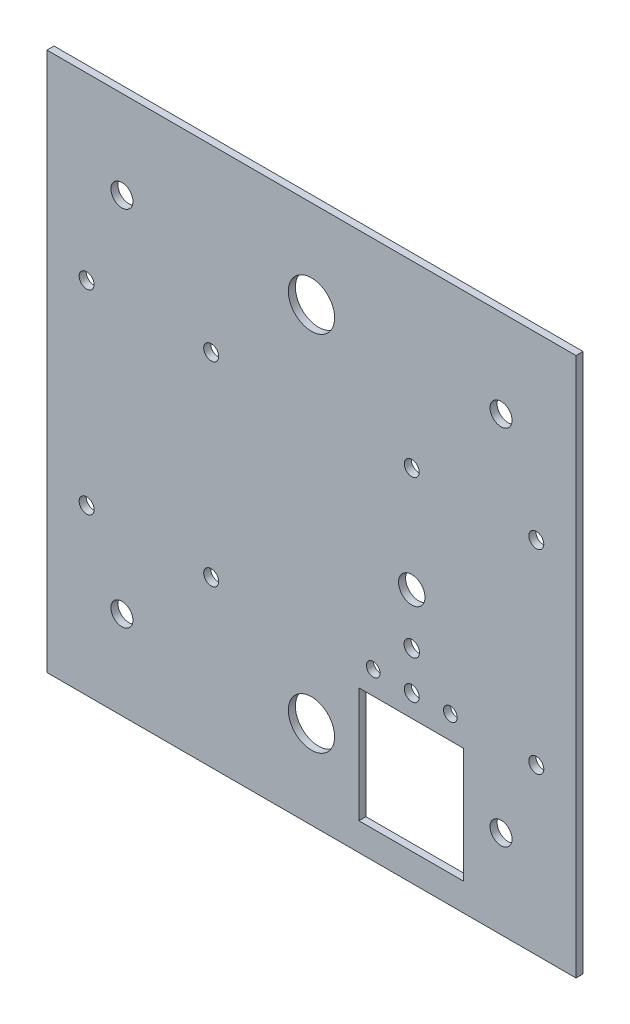
from build123d import *

# Parameters (mm, degrees)
SKETCH1_R                  = 5.25
SKETCH1_R_2                = 2.5
BOSS_EXTRUDE1_DEPTH        = 1.6
SKETCH3_W                  = 120
SKETCH3_H                  = 1.6
BOSS_EXTRUDE3_DEPTH        = 60
SKETCH4_R                  = 3
SKETCH4_R_2                = 1.55
SKETCH4_R_3                = 1.75
CUT_EXTRUDE1_DEPTH         = 10
SKETCH6_R                  = 1.7
CUT_EXTRUDE2_DEPTH         = 25
CONVERT_SOLID1_START       = -61
CONVERT_SOLID1_DEPTH       = 122
CONVERT_SOLID1_START_2     = -60
CONVERT_SOLID1_2_DEPTH     = 120
CUT_EXTRUDE3_OUTLINE_W     = 120
CUT_EXTRUDE3_OUTLINE_H     = 60
CUT_EXTRUDE3_OUTLINE_R     = 1.7
CUT_EXTRUDE3_OUTLINE_R_2   = 1.55
CUT_EXTRUDE3_OUTLINE_R_3   = 1.75
CUT_EXTRUDE3_OUTLINE_R_4   = 3
CUT_EXTRUDE3_DEPTH         = 32
CUT_EXTRUDE3_START         = -1.6
CUT_EXTRUDE3_2_OUTLINE_W   = 23.75
CUT_EXTRUDE3_2_OUTLINE_H   = 1.229203673
CUT_EXTRUDE3_2_DEPTH       = 1.6
CUT_EXTRUDE3_3_OUTLINE_W   = 120
CUT_EXTRUDE3_3_OUTLINE_H   = 122.283185308
CUT_EXTRUDE3_3_OUTLINE_W_2 = 23.75
CUT_EXTRUDE3_3_OUTLINE_H_2 = 26.1
CUT_EXTRUDE3_3_OUTLINE_R   = 2.5
CUT_EXTRUDE3_3_OUTLINE_R_2 = 5.25
CUT_EXTRUDE3_3_OUTLINE_R_3 = 1.7
CUT_EXTRUDE3_3_OUTLINE_R_4 = 1.55
CUT_EXTRUDE3_3_OUTLINE_R_5 = 1.75
CUT_EXTRUDE3_3_OUTLINE_R_6 = 3
CUT_EXTRUDE3_3_DEPTH       = 1.6


with BuildPart() as part:
    # Sketch1 → Boss-Extrude1 (new body)
    with BuildSketch(Plane(origin=(0, 0, 0), x_dir=(1, 0, 0), z_dir=(0, 1, 0))):
        Polygon((-60, -12), (-60, 20), (60, 20), (60, -12), (34.5, -12), (11, -12), align=None)
        with Locations(Location((0, 0, 0), (0, 0, 270))):
            Circle(SKETCH1_R, mode=Mode.SUBTRACT)
        with Locations(Location((-43, 0, 0), (0, 0, 270))):
            Circle(SKETCH1_R_2, mode=Mode.SUBTRACT)
        with Locations(Location((43, 0, 0), (0, 0, 90))):
            Circle(SKETCH1_R_2, mode=Mode.SUBTRACT)
    boss_extrude1 = extrude(amount=BOSS_EXTRUDE1_DEPTH)

    # Sketch3 → Boss-Extrude3 (add)
    with BuildSketch(Plane.XZ):
        with Locations((0, 12.8)):
            Rectangle(SKETCH3_W, SKETCH3_H)
    extrude(amount=-BOSS_EXTRUDE3_DEPTH)

    # Mirror1: Boss-Extrude1 across plane
    add(boss_extrude1.mirror(Plane.ZX.offset(30)))

    # Sketch4 → Cut-Extrude1 (cut)
    with BuildSketch(Plane.XY.offset(12)):
        with Locations(Location((22.75, 26.5, 0), (0, 0, 180))):
            Circle(SKETCH4_R)
        with Locations(Location((31.5, 6.5, 0), (0, 0, 180))):
            Circle(SKETCH4_R_2)
        with Locations(Location((14, 6.5, 0), (0, 0, 180))):
            Circle(SKETCH4_R_2)
        with Locations(Location((22.75, 15, 0), (0, 0, 180))):
            Circle(SKETCH4_R_3)
    extrude(amount=CUT_EXTRUDE1_DEPTH, mode=Mode.SUBTRACT)

    # Sketch6 → Cut-Extrude2 (cut)
    with BuildSketch(Plane(origin=(124.244525073, 40.7, 12), x_dir=(1, 0, 0), z_dir=(0, 0, 1))):
        with Locations(Location((-175.244525073, 9.7, 0), (0, 0, 180))):
            Circle(SKETCH6_R)
        with Locations(Location((-146.994525073, 9.7, 0), (0, 0, 180))):
            Circle(SKETCH6_R)
        with Locations(Location((-101.494525073, 9.7, 0), (0, 0, 180))):
            Circle(SKETCH6_R)
        with Locations(Location((-73.244525073, 9.7, 0), (0, 0, 180))):
            Circle(SKETCH6_R)
        with Locations((-175.244525073, -34.5)):
            Circle(SKETCH6_R)
        with Locations((-146.994525073, -34.5)):
            Circle(SKETCH6_R)
        with Locations(Location((-101.494525073, -34.5, 0), (0, 0, 180))):
            Circle(SKETCH6_R)
        with Locations(Location((-73.244525073, -34.5, 0), (0, 0, 180))):
            Circle(SKETCH6_R)
    extrude(amount=CUT_EXTRUDE2_DEPTH, mode=Mode.SUBTRACT)

    # Convert-Solid1: read off the stored shape, not the designer's step
    # Convert-Solid1 outline → Convert-Solid1 (cut)
    with BuildSketch(Plane.YZ.offset(CONVERT_SOLID1_START)):
        with BuildLine():
            Line((60, 13.6), (57.2, 13.6))
            ThreePointArc((57.2, 13.6), (59.179898987, 12.779898987), (60, 10.8))
            Line((60, 10.8), (60, 13.6))
        make_face()
        with BuildLine():
            ThreePointArc((0, 10.8), (0.820101013, 12.779898987), (2.8, 13.6))
            Line((2.8, 13.6), (0, 13.6))
            Line((0, 13.6), (0, 10.8))
        make_face()
    extrude(amount=CONVERT_SOLID1_DEPTH, mode=Mode.SUBTRACT)

    # Convert-Solid1 2 outline → Convert-Solid1 2 (add)
    with BuildSketch(Plane.YZ.offset(CONVERT_SOLID1_START_2)):
        with BuildLine():
            Line((58.4, 12), (57.2, 12))
            ThreePointArc((57.2, 12), (58.048528137, 11.648528137), (58.4, 10.8))
            Line((58.4, 10.8), (58.4, 12))
        make_face()
        with BuildLine():
            ThreePointArc((1.6, 10.8), (1.951471863, 11.648528137), (2.8, 12))
            Line((2.8, 12), (1.6, 12))
            Line((1.6, 12), (1.6, 10.8))
        make_face()
    extrude(amount=CONVERT_SOLID1_2_DEPTH)

    # Cut-Extrude3: read off the stored shape, not the designer's step
    # Cut-Extrude3 outline → Cut-Extrude3 (cut)
    with BuildSketch(Plane(origin=(0, 0, 12), x_dir=(-1, 0, 0), z_dir=(0, 0, -1))):
        with Locations((0, 30)):
            Rectangle(CUT_EXTRUDE3_OUTLINE_W, CUT_EXTRUDE3_OUTLINE_H)
        with Locations((51, 50.4)):
            Circle(CUT_EXTRUDE3_OUTLINE_R, mode=Mode.SUBTRACT)
        with Locations((-51, 6.2)):
            Circle(CUT_EXTRUDE3_OUTLINE_R, mode=Mode.SUBTRACT)
        with Locations((-31.5, 6.5)):
            Circle(CUT_EXTRUDE3_OUTLINE_R_2, mode=Mode.SUBTRACT)
        with Locations((-22.75, 6.2)):
            Circle(CUT_EXTRUDE3_OUTLINE_R, mode=Mode.SUBTRACT)
        with Locations((-14, 6.5)):
            Circle(CUT_EXTRUDE3_OUTLINE_R_2, mode=Mode.SUBTRACT)
        with Locations((-22.75, 15)):
            Circle(CUT_EXTRUDE3_OUTLINE_R_3, mode=Mode.SUBTRACT)
        with Locations((-22.75, 26.5)):
            Circle(CUT_EXTRUDE3_OUTLINE_R_4, mode=Mode.SUBTRACT)
        with Locations((22.75, 6.2)):
            Circle(CUT_EXTRUDE3_OUTLINE_R, mode=Mode.SUBTRACT)
        with Locations((51, 6.2)):
            Circle(CUT_EXTRUDE3_OUTLINE_R, mode=Mode.SUBTRACT)
        with Locations((-51, 50.4)):
            Circle(CUT_EXTRUDE3_OUTLINE_R, mode=Mode.SUBTRACT)
        with Locations((-22.75, 50.4)):
            Circle(CUT_EXTRUDE3_OUTLINE_R, mode=Mode.SUBTRACT)
        with Locations((22.75, 50.4)):
            Circle(CUT_EXTRUDE3_OUTLINE_R, mode=Mode.SUBTRACT)
    extrude(amount=CUT_EXTRUDE3_DEPTH, mode=Mode.SUBTRACT)

    # Cut-Extrude3 2 outline → Cut-Extrude3 2 (cut)
    with BuildSketch(Plane(origin=(0, 0, 12), x_dir=(-1, 0, 0), z_dir=(0, 0, -1)).offset(CUT_EXTRUDE3_START)):
        with Locations((-22.625, 0.614601836)):
            Rectangle(CUT_EXTRUDE3_2_OUTLINE_W, CUT_EXTRUDE3_2_OUTLINE_H)
    extrude(amount=CUT_EXTRUDE3_2_DEPTH, mode=Mode.SUBTRACT)

    # Cut-Extrude3 3 outline → Cut-Extrude3 3 (add)
    with BuildSketch(Plane(origin=(0, 0, 12), x_dir=(-1, 0, 0), z_dir=(0, 0, -1)).offset(CUT_EXTRUDE3_START)):
        with Locations((0, 30)):
            Rectangle(CUT_EXTRUDE3_3_OUTLINE_W, CUT_EXTRUDE3_3_OUTLINE_H)
        with Locations((-22.625, -11.820796327)):
            Rectangle(CUT_EXTRUDE3_3_OUTLINE_W_2, CUT_EXTRUDE3_3_OUTLINE_H_2, mode=Mode.SUBTRACT)
        with Locations((-43, -11.141592654)):
            Circle(CUT_EXTRUDE3_3_OUTLINE_R, mode=Mode.SUBTRACT)
        with Locations((0, -11.141592654)):
            Circle(CUT_EXTRUDE3_3_OUTLINE_R_2, mode=Mode.SUBTRACT)
        with Locations((43, -11.141592654)):
            Circle(CUT_EXTRUDE3_3_OUTLINE_R, mode=Mode.SUBTRACT)
        with Locations((51, 50.4)):
            Circle(CUT_EXTRUDE3_3_OUTLINE_R_3, mode=Mode.SUBTRACT)
        with Locations((-51, 6.2)):
            Circle(CUT_EXTRUDE3_3_OUTLINE_R_3, mode=Mode.SUBTRACT)
        with Locations((-31.5, 6.5)):
            Circle(CUT_EXTRUDE3_3_OUTLINE_R_4, mode=Mode.SUBTRACT)
        with Locations((-22.75, 6.2)):
            Circle(CUT_EXTRUDE3_3_OUTLINE_R_3, mode=Mode.SUBTRACT)
        with Locations((-14, 6.5)):
            Circle(CUT_EXTRUDE3_3_OUTLINE_R_4, mode=Mode.SUBTRACT)
        with Locations((-22.75, 15)):
            Circle(CUT_EXTRUDE3_3_OUTLINE_R_5, mode=Mode.SUBTRACT)
        with Locations((-22.75, 26.5)):
            Circle(CUT_EXTRUDE3_3_OUTLINE_R_6, mode=Mode.SUBTRACT)
        with Locations((22.75, 6.2)):
            Circle(CUT_EXTRUDE3_3_OUTLINE_R_3, mode=Mode.SUBTRACT)
        with Locations((51, 6.2)):
            Circle(CUT_EXTRUDE3_3_OUTLINE_R_3, mode=Mode.SUBTRACT)
        with Locations((-51, 50.4)):
            Circle(CUT_EXTRUDE3_3_OUTLINE_R_3, mode=Mode.SUBTRACT)
        with Locations((-22.75, 50.4)):
            Circle(CUT_EXTRUDE3_3_OUTLINE_R_3, mode=Mode.SUBTRACT)
        with Locations((22.75, 50.4)):
            Circle(CUT_EXTRUDE3_3_OUTLINE_R_3, mode=Mode.SUBTRACT)
        with Locations((43, 71.141592654)):
            Circle(CUT_EXTRUDE3_3_OUTLINE_R, mode=Mode.SUBTRACT)
        with Locations((-43, 71.141592654)):
            Circle(CUT_EXTRUDE3_3_OUTLINE_R, mode=Mode.SUBTRACT)
        with Locations((0, 71.141592654)):
            Circle(CUT_EXTRUDE3_3_OUTLINE_R_2, mode=Mode.SUBTRACT)
    extrude(amount=CUT_EXTRUDE3_3_DEPTH)


solid = part.part
